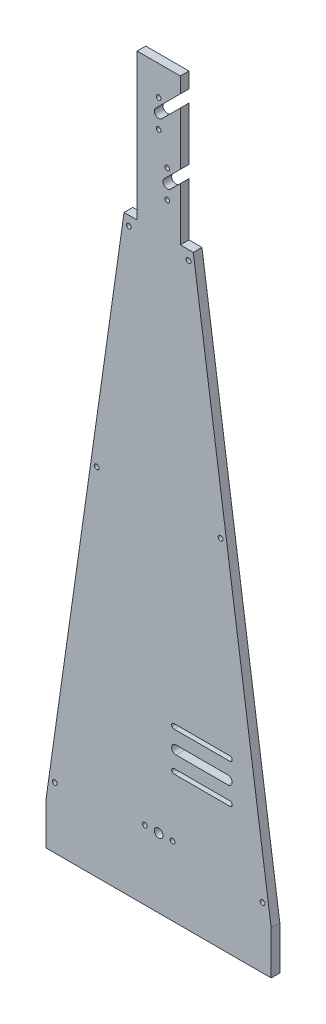
from build123d import *

# Parameters (mm, degrees)
AUFSATZ_LINEAR_AUSTRAGEN1_DEPTH       = 10
SKIZZE17_R                            = 2.75
SCHNITT_LINEAR_AUSTRAGEN1_DEPTH       = 10
F_10_0_10_DURCHMESSER_BOHRUNG1_D      = 10
F_5_5_5_5_DURCHMESSER_BOHRUNG2_D      = 5.5
F_10_0_10_DURCHMESSER_LANGLOCH2_DEPTH = 10
F_5_5_5_5_DURCHMESSER_LANGLOCH2_DEPTH = 10
F_5_5_5_5_DURCHMESSER_BOHRUNG3_D      = 5.5


# Read off the part's stored shape, not the designer's step: Ø10.0 (10) Durchmesser Langloch2, Ø5.5 (5.5) Durchmesser Langloch2
with BuildPart() as part:
    # Skizze1 → Aufsatz-Linear austragen1 (new body)
    with BuildSketch(Plane.XY):
        Polygon((-40, 681), (-130, 50), (-130, 0), (0, 0), (0, 800), (0, 850), (-25, 850), (-25, 800), (-25, 681), align=None)
    aufsatz_linear_austragen1 = extrude(amount=AUFSATZ_LINEAR_AUSTRAGEN1_DEPTH)

    # Spiegeln1: Aufsatz-Linear austragen1 across plane
    add(aufsatz_linear_austragen1.mirror(Plane(origin=(0, 800, 10), x_dir=(0, 0, 1), z_dir=(1, 0, 0))))

    # Skizze17 → Schnitt-Linear austragen1 (cut)
    with BuildSketch(Plane.XY.offset(10)):
        with Locations((0, 816)):
            Circle(SKIZZE17_R)
        with Locations((0, 784)):
            Circle(SKIZZE17_R)
        with Locations((10, 750.444801834)):
            Circle(SKIZZE17_R)
        with Locations((10, 718.444801834)):
            Circle(SKIZZE17_R)
        with BuildLine():
            Line((-3.535533906, 803.535533906), (25, 832.071067812))
            ThreePointArc((25, 832.071067812), (32.071067812, 832.071067812), (32.071067812, 825))
            Line((32.071067812, 825), (3.535533906, 796.464466094))
            ThreePointArc((3.535533906, 796.464466094), (-3.535533906, 796.464466094), (-3.535533906, 803.535533906))
        make_face()
        with BuildLine():
            Line((6.464466094, 737.98033574), (25, 756.515869646))
            ThreePointArc((25, 756.515869646), (32.071067812, 756.515869646), (32.071067812, 749.444801834))
            Line((32.071067812, 749.444801834), (13.535533906, 730.909267928))
            ThreePointArc((13.535533906, 730.909267928), (6.464466094, 730.909267928), (6.464466094, 737.98033574))
        make_face()
    extrude(amount=-SCHNITT_LINEAR_AUSTRAGEN1_DEPTH, mode=Mode.SUBTRACT)

    # Ø10.0 (10) Durchmesser Bohrung1 (through all)
    with Locations(Plane.XY.offset(10)):
        with Locations((0, 80)):
            Hole(F_10_0_10_DURCHMESSER_BOHRUNG1_D / 2)

    # Ø5.5 (5.5) Durchmesser Bohrung2 (through all)
    with Locations(Plane.XY.offset(10)):
        with Locations((-16, 80), (16, 80)):
            Hole(F_5_5_5_5_DURCHMESSER_BOHRUNG2_D / 2)

    # Ø10.0 (10) Durchmesser Langloch2 outline → Ø10.0 (10) Durchmesser Langloch2 (cut)
    with BuildSketch(Plane.XY):
        with BuildLine():
            Line((20, 168.190997141), (80, 168.190997141))
            ThreePointArc((80, 168.190997141), (85, 173.190997141), (80, 178.190997141))
            Line((80, 178.190997141), (20, 178.190997141))
            ThreePointArc((20, 178.190997141), (15, 173.190997141), (20, 168.190997141))
        make_face()
    extrude(amount=F_10_0_10_DURCHMESSER_LANGLOCH2_DEPTH, mode=Mode.SUBTRACT)

    # Ø5.5 (5.5) Durchmesser Langloch2 outline → Ø5.5 (5.5) Durchmesser Langloch2 (cut)
    with BuildSketch(Plane.XY):
        with BuildLine():
            Line((17.75, 147.940997141), (82.25, 147.940997141))
            ThreePointArc((82.25, 147.940997141), (85, 150.690997141), (82.25, 153.440997141))
            Line((82.25, 153.440997141), (17.75, 153.440997141))
            ThreePointArc((17.75, 153.440997141), (15, 150.690997141), (17.75, 147.940997141))
        make_face()
        with BuildLine():
            Line((17.75, 192.940997141), (82.25, 192.940997141))
            ThreePointArc((82.25, 192.940997141), (85, 195.690997141), (82.25, 198.440997141))
            Line((82.25, 198.440997141), (17.75, 198.440997141))
            ThreePointArc((17.75, 198.440997141), (15, 195.690997141), (17.75, 192.940997141))
        make_face()
    extrude(amount=F_5_5_5_5_DURCHMESSER_LANGLOCH2_DEPTH, mode=Mode.SUBTRACT)

    # Ø5.5 (5.5) Durchmesser Bohrung3 (through all)
    with Locations(Plane.XY.offset(10)):
        with Locations((-34.48740284, 670.074959222), (-71.470822821, 410.780092469), (-119.989782887, 70.608272452)):
            f_5_5_5_5_durchmesser_bohrung3 = Hole(F_5_5_5_5_DURCHMESSER_BOHRUNG3_D / 2)

    # Spiegeln2: Ø5.5 (5.5) Durchmesser Bohrung3 across plane
    add(f_5_5_5_5_durchmesser_bohrung3.mirror(Plane(origin=(0, 0, 0), x_dir=(0, 0, 1), z_dir=(1, 0, 0))), mode=Mode.SUBTRACT)


solid = part.part
